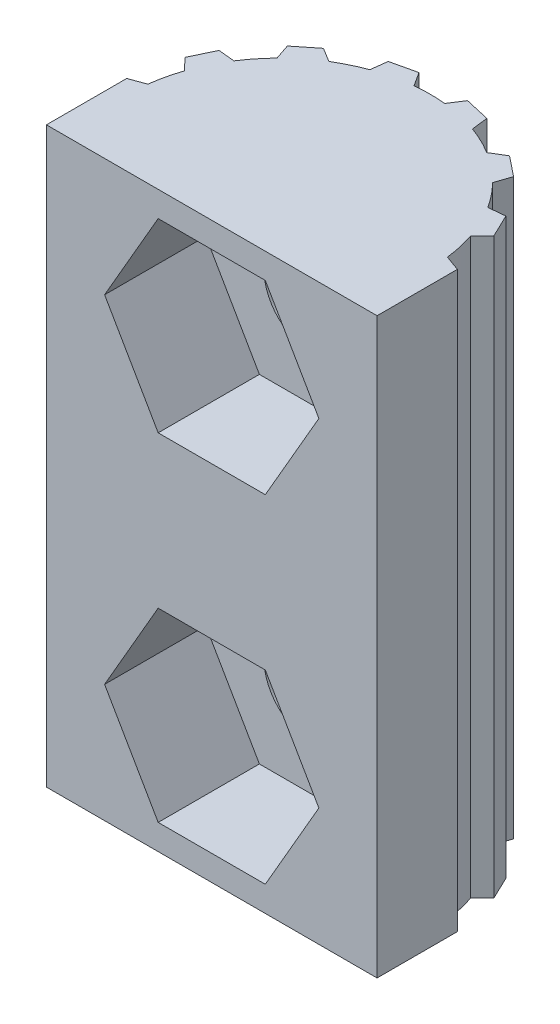
from build123d import *

# Parameters (mm, degrees)
BOSS_EXTRUDE1_DEPTH             = 8.5
BOSS_EXTRUDE2_REACH             = 12.596
BOSS_EXTRUDE2_DIRECTION_2_REACH = 12.596
CIRPATTERN1_COUNT               = 8
CIRPATTERN1_ANGLE               = 180
CUT_EXTRUDE1_DEPTH              = 19.347920123
CUT_EXTRUDE1_DEPTH_BACK         = 19.347920123
SKETCH10_W                      = 9.8
SKETCH10_H                      = 17
BOSS_EXTRUDE3_DEPTH             = 2
M2_5_CLEARANCE_HOLE1_D          = 2.9
CUT_EXTRUDE2_DEPTH              = 3


with BuildPart() as part:
    # Sketch1 → Boss-Extrude1 (new, symmetric)
    with BuildSketch(Plane(origin=(0, 0, 0), x_dir=(1, 0, 0), z_dir=(0, 1, 0))):
        with BuildLine():
            Line((-4.473619962, 0), (4.473619962, 0))
            ThreePointArc((4.473619962, 0), (0, 4.473619962), (-4.473619962, 0))
        make_face()
    extrude(amount=BOSS_EXTRUDE1_DEPTH, both=True)

    # Boss-Extrude2: up to this face of the body (flat: up to its plane)
    boss_extrude2_end = Plane(part.part.faces().sort_by_distance((0, 8.5, -1.898663281))[0])
    # Sketch1<3> → Boss-Extrude2 (add, up to the picked face)
    with BuildSketch(Plane(origin=(0, 0, 0), x_dir=(1, 0, 0), z_dir=(0, 1, 0)), mode=Mode.PRIVATE) as boss_extrude2_sk1:
        with BuildLine():
            Line((-4.44, 0), (-4.473619962, 0))
            ThreePointArc((-4.473619962, 0), (-4.465207061, 0.274228857), (-4.44, 0.547426308))
            Line((-4.44, 0.547426308), (-4.9, 0.38))
            Line((-4.9, 0.38), (-4.9, -0.38))
            Line((-4.9, -0.38), (-4.44, -0.547426308))
            Line((-4.44, -0.547426308), (-4.44, 0))
        make_face()
    boss_extrude2_tool1 = split(extrude(boss_extrude2_sk1.sketch, amount=BOSS_EXTRUDE2_REACH, mode=Mode.PRIVATE), bisect_by=boss_extrude2_end, keep=Keep.BOTH, mode=Mode.PRIVATE)
    boss_extrude2 = boss_extrude2_tool1.solids().sort_by(Axis((-4.662167, 0, 0.006087), (0, 1, 0)))[0]
    add(boss_extrude2)

    # Boss-Extrude2 direction 2: up to this face of the body (flat: up to its plane)
    boss_extrude2_direction_2_end = Plane(part.part.faces().sort_by_distance((0, -8.5, -1.898663281))[0])
    # Sketch1<3> → Boss-Extrude2 direction 2 (add, up to the picked face)
    with BuildSketch(Plane(origin=(0, 0, 0), x_dir=(1, 0, 0), z_dir=(0, 1, 0)), mode=Mode.PRIVATE) as boss_extrude2_direction_2_sk1:
        with BuildLine():
            Line((-4.44, 0), (-4.473619962, 0))
            ThreePointArc((-4.473619962, 0), (-4.465207061, 0.274228857), (-4.44, 0.547426308))
            Line((-4.44, 0.547426308), (-4.9, 0.38))
            Line((-4.9, 0.38), (-4.9, -0.38))
            Line((-4.9, -0.38), (-4.44, -0.547426308))
            Line((-4.44, -0.547426308), (-4.44, 0))
        make_face()
    boss_extrude2_direction_2_tool1 = split(extrude(boss_extrude2_direction_2_sk1.sketch, amount=-BOSS_EXTRUDE2_DIRECTION_2_REACH, mode=Mode.PRIVATE), bisect_by=boss_extrude2_direction_2_end, keep=Keep.BOTH, mode=Mode.PRIVATE)
    boss_extrude2_direction_2 = boss_extrude2_direction_2_tool1.solids().sort_by(Axis((-4.662167, 0, 0.006087), (0, -1, 0)))[0]
    add(boss_extrude2_direction_2)

    # CirPattern1: Boss-Extrude2, Boss-Extrude2 direction 2 ×8 about axis
    cirpattern1_axis = Axis((0, 8.5, 0), (0, -1, 0))
    add([boss_extrude2.rotate(cirpattern1_axis, i * CIRPATTERN1_ANGLE / (CIRPATTERN1_COUNT - 1)) for i in range(1, CIRPATTERN1_COUNT)])
    add([boss_extrude2_direction_2.rotate(cirpattern1_axis, i * CIRPATTERN1_ANGLE / (CIRPATTERN1_COUNT - 1)) for i in range(1, CIRPATTERN1_COUNT)])

    # Sketch4 → Cut-Extrude1 (cut, two sides: drawn at the far end of the back side and taken through both)
    with BuildSketch(Plane(origin=(0, 8.5, 0), x_dir=(1, 0, 0), z_dir=(0, 1, 0)).offset(-CUT_EXTRUDE1_DEPTH_BACK)):
        Polygon((-36.779321089, 0), (-4.9, 0), (4.9, 0), (36.779321089, 0), (36.779321089, -63.758642178), (-36.779321089, -63.758642178), align=None)
    extrude(amount=CUT_EXTRUDE1_DEPTH + CUT_EXTRUDE1_DEPTH_BACK, mode=Mode.SUBTRACT)

    # Sketch10 → Boss-Extrude3 (add)
    with BuildSketch(Plane.XY):
        Rectangle(SKETCH10_W, SKETCH10_H)
    extrude(amount=BOSS_EXTRUDE3_DEPTH)

    # M2.5 Clearance Hole1 (through all)
    with Locations(Plane(origin=(-2.188156234, 1.776538328, 2), x_dir=(1, 0, 0), z_dir=(0, 0, 1))):
        with Locations((2.188156234, 3.223461672), (2.188156234, -6.776538328)):
            Hole(M2_5_CLEARANCE_HOLE1_D / 2)

    # Sketch9 → Cut-Extrude2 (cut)
    with BuildSketch(Plane.XY.offset(2)):
        Polygon((-3.175426481, 5), (-1.58771324, 2.25), (1.58771324, 2.25), (3.175426481, 5), (1.58771324, 7.75), (-1.58771324, 7.75), align=None)
        Polygon((-3.175426481, -5), (-1.58771324, -7.75), (1.58771324, -7.75), (3.175426481, -5), (1.58771324, -2.25), (-1.58771324, -2.25), align=None)
    extrude(amount=-CUT_EXTRUDE2_DEPTH, mode=Mode.SUBTRACT)


solid = part.part
